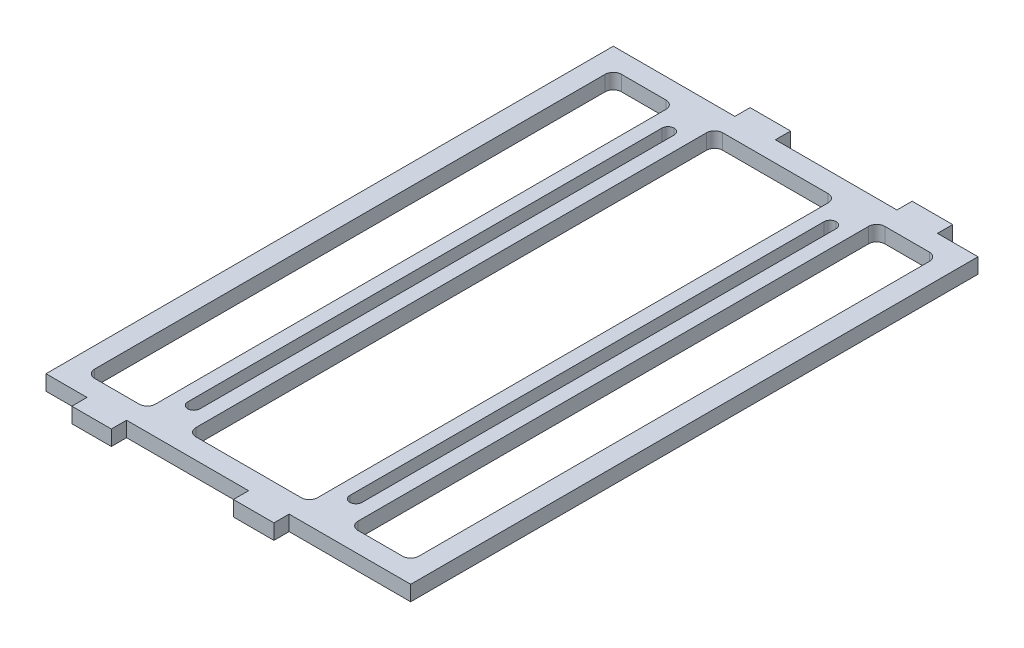
from build123d import *

# Parameters (mm, degrees)
SKETCH1_W           = 114.3
SKETCH1_H           = 177.8
SKETCH1_W_2         = 101.6
SKETCH1_H_2         = 165.1
BOSS_EXTRUDE1_DEPTH = 4.7625
SKETCH2_W           = 12.38677804
SKETCH2_H           = 4.7625
SKETCH2_W_2         = 12.7
BOSS_EXTRUDE2_DEPTH = 4.7625
SKETCH3_W           = 12.7
SKETCH3_H           = 4.7625
BOSS_EXTRUDE3_DEPTH = 4.7625
FILLET1_R           = 2.54
SKETCH7_W           = 12.7
SKETCH7_H           = 165.1
SKETCH7_W_2         = 3.81
SKETCH7_H_2         = 152.4
BOSS_EXTRUDE6_DEPTH = 4.7625
FILLET3_R           = 2.54
FILLET4_R           = 1.905


with BuildPart() as part:
    # Sketch1 → Boss-Extrude1 (new body)
    with BuildSketch(Plane(origin=(0, 0, 0), x_dir=(1, 0, 0), z_dir=(0, 1, 0))):
        Rectangle(SKETCH1_W, SKETCH1_H)
        Rectangle(SKETCH1_W_2, SKETCH1_H_2, mode=Mode.SUBTRACT)
    extrude(amount=BOSS_EXTRUDE1_DEPTH)

    # Sketch2 → Boss-Extrude2 (add)
    with BuildSketch(Plane.XY.offset(88.9)):
        with Locations((-38.1, 2.38125)):
            Rectangle(SKETCH2_W, SKETCH2_H)
        with Locations((12.7, 2.38125)):
            Rectangle(SKETCH2_W_2, SKETCH2_H)
    extrude(amount=BOSS_EXTRUDE2_DEPTH)

    # Sketch3 → Boss-Extrude3 (add)
    with BuildSketch(Plane(origin=(0, 0, -88.9), x_dir=(-1, 0, 0), z_dir=(0, 0, -1))):
        with Locations((-38.1, 2.38125)):
            Rectangle(SKETCH3_W, SKETCH3_H)
        with Locations((12.7, 2.38125)):
            Rectangle(SKETCH3_W, SKETCH3_H)
    extrude(amount=BOSS_EXTRUDE3_DEPTH)

    # Fillet1
    fillet1_edges = [part.edges().sort_by_distance(p)[0] for p in [
        (50.8, 2.38125, 82.55),
        (50.8, 2.38125, -82.55),
        (-50.8, 2.38125, -82.55),
        (-50.8, 2.38125, 82.55),
    ]]
    fillet(fillet1_edges, radius=FILLET1_R)

    # Sketch7 → Boss-Extrude6 (add)
    # profile 1 of 2: a face of its own
    with BuildSketch(Plane(origin=(0, 4.7625, 0), x_dir=(1, 0, 0), z_dir=(0, 1, 0))):
        with Locations((-25.4, 0)):
            Rectangle(SKETCH7_W, SKETCH7_H)
        with Locations((-25.4, 0)):
            Rectangle(SKETCH7_W_2, SKETCH7_H_2, mode=Mode.SUBTRACT)
    # profile 2 of 2: a face of its own
    with BuildSketch(Plane(origin=(0, 4.7625, 0), x_dir=(1, 0, 0), z_dir=(0, 1, 0))):
        with Locations((25.4, 0)):
            Rectangle(SKETCH7_W, SKETCH7_H)
        with Locations((25.4, 0)):
            Rectangle(SKETCH7_W_2, SKETCH7_H_2, mode=Mode.SUBTRACT)
    extrude(amount=-BOSS_EXTRUDE6_DEPTH)

    # Fillet3
    fillet3_edges = [part.edges().sort_by_distance(p)[0] for p in [
        (-31.75, 2.38125, 82.55),
        (-31.75, 2.38125, -82.55),
        (-19.05, 2.38125, -82.55),
        (-19.05, 2.38125, 82.55),
        (19.05, 2.38125, 82.55),
        (19.05, 2.38125, -82.55),
        (31.75, 2.38125, -82.55),
        (31.75, 2.38125, 82.55),
    ]]
    fillet(fillet3_edges, radius=FILLET3_R)

    # Fillet4
    fillet4_edges = [part.edges().sort_by_distance(p)[0] for p in [
        (27.305, 2.38125, -76.2),
        (23.495, 2.38125, -76.2),
        (27.305, 2.38125, 76.2),
        (23.495, 2.38125, 76.2),
        (-23.495, 2.38125, 76.2),
        (-27.305, 2.38125, 76.2),
        (-23.495, 2.38125, -76.2),
        (-27.305, 2.38125, -76.2),
    ]]
    fillet(fillet4_edges, radius=FILLET4_R - 0.0001)  # a hair under: the kernel refuses the full size


solid = part.part
